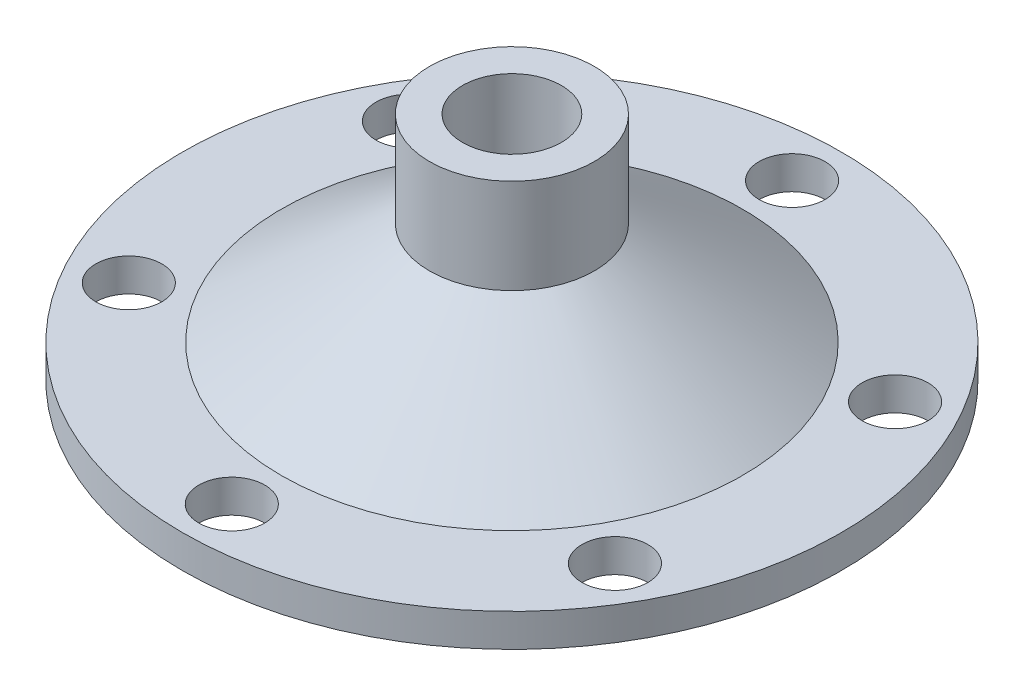
from build123d import *

# Parameters (mm, degrees)
SKETCH1_R           = 127
BOSS_EXTRUDE1_DEPTH = 12.7
SKETCH2_R           = 12.7
CUT_EXTRUDE2_DEPTH  = 12.7
SKETCH4_R           = 88.9
BOSS_EXTRUDE2_DEPTH = 39.6875
CHAMFER2_SIZE2      = 57.124100733
CHAMFER2_SIZE       = 39.6875
SKETCH6_R           = 31.775899267
BOSS_EXTRUDE3_DEPTH = 36.5125
SKETCH7_R           = 19.05
CUT_EXTRUDE3_DEPTH  = 155.3845


with BuildPart() as part:
    # Sketch1 → Boss-Extrude1 (new body)
    with BuildSketch(Plane(origin=(0, 0, 0), x_dir=(1, 0, 0), z_dir=(0, 1, 0))):
        with Locations(Location((0, 0, 0), (0, 0, 270))):
            Circle(SKETCH1_R)
    extrude(amount=BOSS_EXTRUDE1_DEPTH)

    # Sketch2 → Cut-Extrude2 (cut)
    with BuildSketch(Plane(origin=(0, 12.7, 0), x_dir=(1, 0, 0), z_dir=(0, 1, 0))):
        with Locations(Location((0, 107.95, 0), (0, 0, 270))):
            Circle(SKETCH2_R)
        with Locations(Location((0, -107.95, 0), (0, 0, 270))):
            Circle(SKETCH2_R)
        with Locations(Location((-93.6625, 53.975, 0), (0, 0, 270))):
            Circle(SKETCH2_R)
        with Locations(Location((93.6625, 53.975, 0), (0, 0, 270))):
            Circle(SKETCH2_R)
        with Locations(Location((-93.6625, -53.975, 0), (0, 0, 270))):
            Circle(SKETCH2_R)
        with Locations(Location((93.6625, -53.975, 0), (0, 0, 270))):
            Circle(SKETCH2_R)
    extrude(amount=-CUT_EXTRUDE2_DEPTH, mode=Mode.SUBTRACT)

    # Sketch4 → Boss-Extrude2 (add)
    with BuildSketch(Plane(origin=(0, 12.7, 0), x_dir=(1, 0, 0), z_dir=(0, 1, 0))):
        with Locations(Location((0, 0, 0), (0, 0, 90))):
            Circle(SKETCH4_R)
    extrude(amount=BOSS_EXTRUDE2_DEPTH)

    # Chamfer2
    chamfer2_edges = [part.edges().sort_by_distance(p)[0] for p in [
        (0, 52.3875, 88.9),
    ]]
    chamfer2_side = [part.faces().sort_by_distance(p)[0] for p in [
        (0, 51.59375, 88.9),
    ]]
    chamfer(chamfer2_edges, length=CHAMFER2_SIZE - 0.0001, length2=CHAMFER2_SIZE2 - 0.0001, reference=chamfer2_side[0])  # a hair under: the kernel refuses the full size

    # Sketch6 → Boss-Extrude3 (add)
    with BuildSketch(Plane(origin=(0, 52.3875, 0), x_dir=(1, 0, 0), z_dir=(0, 1, 0))):
        with Locations(Location((0, 0, 0), (0, 0, 270))):
            Circle(SKETCH6_R)
    extrude(amount=BOSS_EXTRUDE3_DEPTH)

    # Sketch7 → Cut-Extrude3 (cut)
    with BuildSketch(Plane(origin=(0, 88.9, 0), x_dir=(1, 0, 0), z_dir=(0, 1, 0))):
        with Locations(Location((0, 0, 0), (0, 0, 270))):
            Circle(SKETCH7_R)
    extrude(amount=-CUT_EXTRUDE3_DEPTH, mode=Mode.SUBTRACT)


solid = part.part
